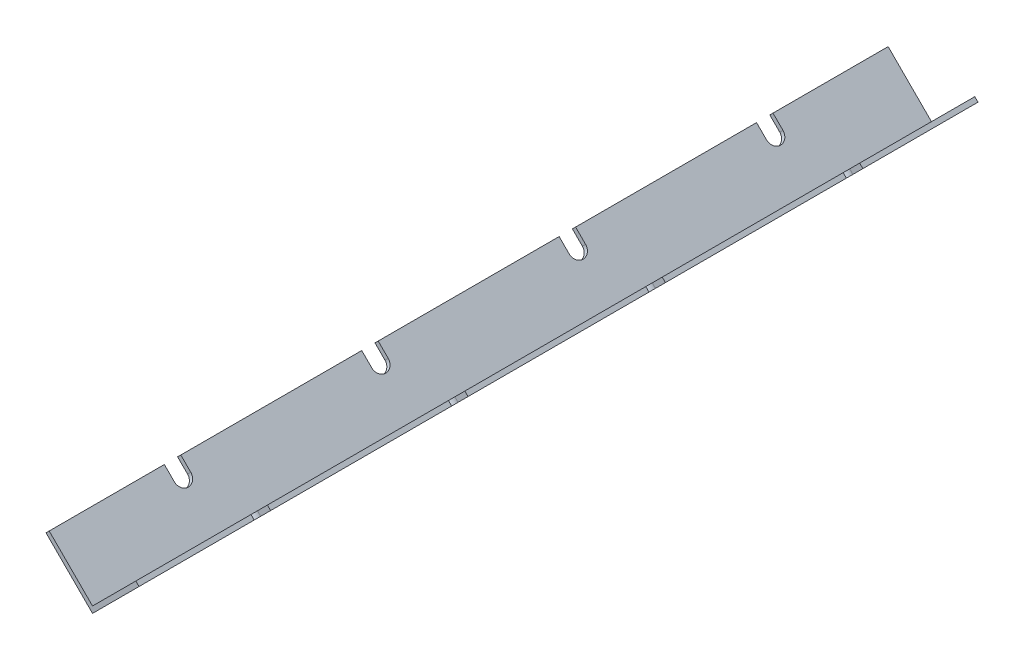
from build123d import *

# Parameters (mm, degrees)
BOSS_EXTRUDE1_DEPTH     = 323.85
CUT_EXTRUDE2_DEPTH      = 325.915161149
CUT_EXTRUDE2_DEPTH_BACK = 325.915161149
CUT_EXTRUDE3_DEPTH      = 325.915161149


with BuildPart() as part:
    # Sketch1 → Boss-Extrude1 (new body)
    with BuildSketch(Plane.XY):
        Polygon((0, 0), (-17.960512242, 17.960512242), (-16.725727025, 19.195297459), (0, 2.469570433), (16.725727025, 19.195297459), (17.960512242, 17.960512242), align=None)
    extrude(amount=BOSS_EXTRUDE1_DEPTH)

    # Sketch3 → Cut-Extrude2 (cut, two sides: drawn at the far end of the back side and taken through both)
    with BuildSketch(Plane(origin=(0, 0, 0), x_dir=(0, 0, -1), z_dir=(1, 0, 0)).offset(-CUT_EXTRUDE2_DEPTH_BACK)):
        with BuildLine():
            Line((-196.85, 19.195297459), (-203.2, 19.195297459))
            Line((-203.2, 19.195297459), (-203.2, 16.274297459))
            ThreePointArc((-203.2, 16.274297459), (-200.025, 13.099297459), (-196.85, 16.274297459))
            Line((-196.85, 16.274297459), (-196.85, 19.195297459))
        make_face()
        with BuildLine():
            Line((-120.65, 19.195297459), (-127, 19.195297459))
            Line((-127, 19.195297459), (-127, 16.274297459))
            ThreePointArc((-127, 16.274297459), (-123.825, 13.099297459), (-120.65, 16.274297459))
            Line((-120.65, 16.274297459), (-120.65, 19.195297459))
        make_face()
        with BuildLine():
            Line((-44.45, 19.195297459), (-50.8, 19.195297459))
            Line((-50.8, 19.195297459), (-50.8, 16.274297459))
            ThreePointArc((-50.8, 16.274297459), (-47.625, 13.099297459), (-44.45, 16.274297459))
            Line((-44.45, 16.274297459), (-44.45, 19.195297459))
        make_face()
        with BuildLine():
            Line((-279.4, 19.195297459), (-279.4, 16.274297459))
            ThreePointArc((-279.4, 16.274297459), (-276.225, 13.099297459), (-273.05, 16.274297459))
            Line((-273.05, 16.274297459), (-273.05, 19.195297459))
            Line((-273.05, 19.195297459), (-279.4, 19.195297459))
        make_face()
    extrude(amount=CUT_EXTRUDE2_DEPTH + CUT_EXTRUDE2_DEPTH_BACK, mode=Mode.SUBTRACT)

    # Sketch4 → Cut-Extrude3 (cut, symmetric)
    with BuildSketch(Plane(origin=(0, 0, 0), x_dir=(0, 0, -1), z_dir=(0.7071067811865506, -0.7071067811865446, 0))):
        with BuildLine():
            Line((-279.4, 25.4), (-279.4, 19.953954124))
            ThreePointArc((-279.4, 19.953954124), (-276.225, 16.778954124), (-273.05, 19.953954124))
            Line((-273.05, 19.953954124), (-273.05, 25.4))
            Line((-273.05, 25.4), (-279.4, 25.4))
        make_face()
        with BuildLine():
            Line((-203.2, 25.4), (-203.2, 19.953954124))
            ThreePointArc((-203.2, 19.953954124), (-200.025, 16.778954124), (-196.85, 19.953954124))
            Line((-196.85, 19.953954124), (-196.85, 25.4))
            Line((-196.85, 25.4), (-203.2, 25.4))
        make_face()
        with BuildLine():
            Line((-127, 25.4), (-127, 19.953954124))
            ThreePointArc((-127, 19.953954124), (-123.825, 16.778954124), (-120.65, 19.953954124))
            Line((-120.65, 19.953954124), (-120.65, 25.4))
            Line((-120.65, 25.4), (-127, 25.4))
        make_face()
        with BuildLine():
            Line((-50.8, 25.4), (-50.8, 19.953954124))
            ThreePointArc((-50.8, 19.953954124), (-47.625, 16.778954124), (-44.45, 19.953954124))
            Line((-44.45, 19.953954124), (-44.45, 25.4))
            Line((-44.45, 25.4), (-50.8, 25.4))
        make_face()
    cut_extrude3 = extrude(amount=CUT_EXTRUDE3_DEPTH, both=True, mode=Mode.SUBTRACT)

    # Mirror1: Cut-Extrude3 across plane
    add(cut_extrude3.mirror(Plane(origin=(0, 0, 0), x_dir=(0, 0, 1), z_dir=(1, 0, 0))), mode=Mode.SUBTRACT)


solid = part.part
